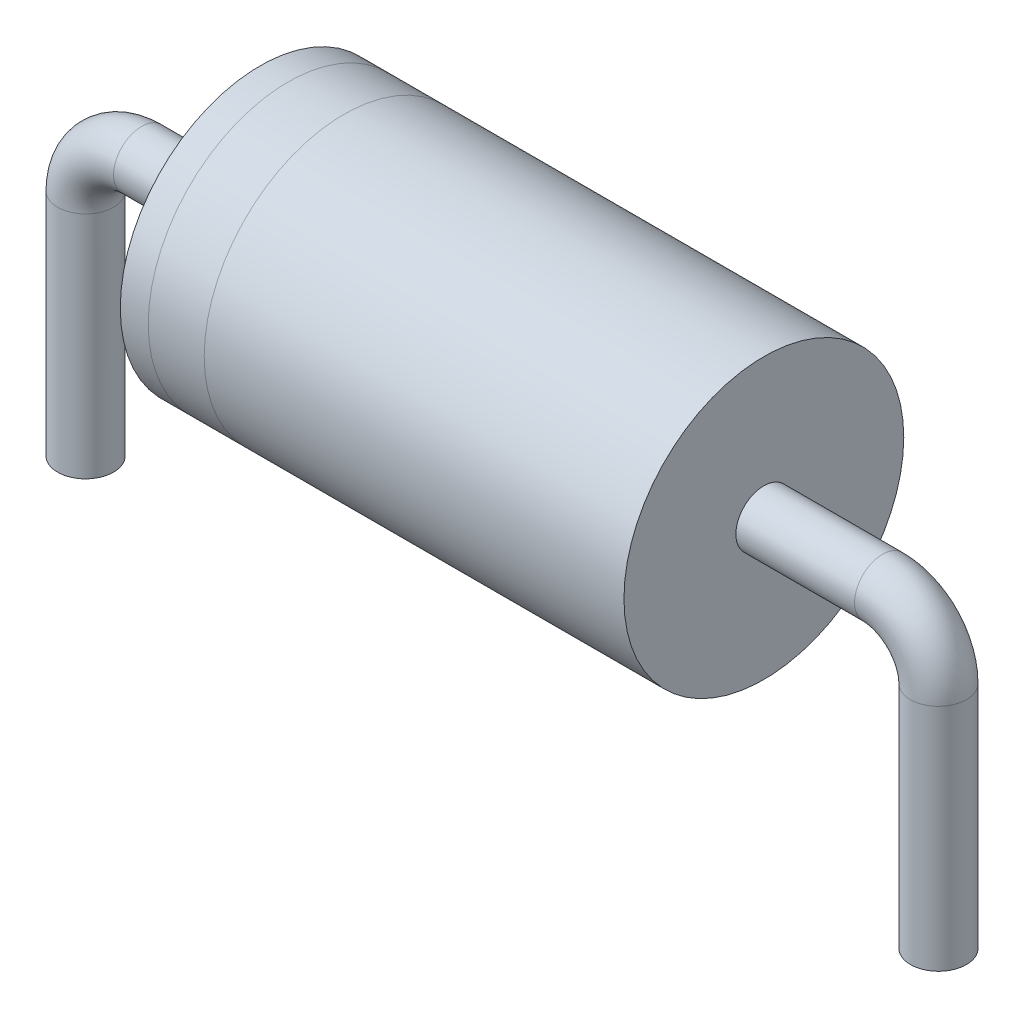
from build123d import *

# Parameters (mm, degrees)
EXTRUDE_1_DEPTH      = 4.5
EXTRUDE_1_DEPTH_BACK = 4.5
SKETCH_1_R           = 2.5
SKETCH_3_R           = 0.5


with BuildPart() as part:
    # Эскиз1 → Бобышка-Вытянуть1 (new, two sides: drawn at the far end of the back side and taken through both)
    with BuildSketch(Plane(origin=(0, 0, 0), x_dir=(0, 0, -1), z_dir=(1, 0, 0)).offset(-EXTRUDE_1_DEPTH_BACK)):
        Circle(SKETCH_1_R)
    extrude(amount=EXTRUDE_1_DEPTH + EXTRUDE_1_DEPTH_BACK)

    # По траектории1: sweep along a path in Эскиз2
    with BuildLine(Plane.XY) as sweep_1_path:
        Line((7.62, -5.1), (7.62, -1))
        ThreePointArc((7.62, -1), (7.327106781, -0.292893219), (6.62, 0))
        Line((6.62, 0), (-6.62, 0))
        ThreePointArc((-6.62, 0), (-7.327106781, -0.292893219), (-7.62, -1))
        Line((-7.62, -1), (-7.62, -5.1))
    # Эскиз3 → По траектории1 (sweep)
    with BuildSketch(Plane(origin=(4.5, 0, 0), x_dir=(0, 0, -1), z_dir=(1, 0, 0))):
        Circle(SKETCH_3_R)
    sweep(path=sweep_1_path.line)


solid = part.part
